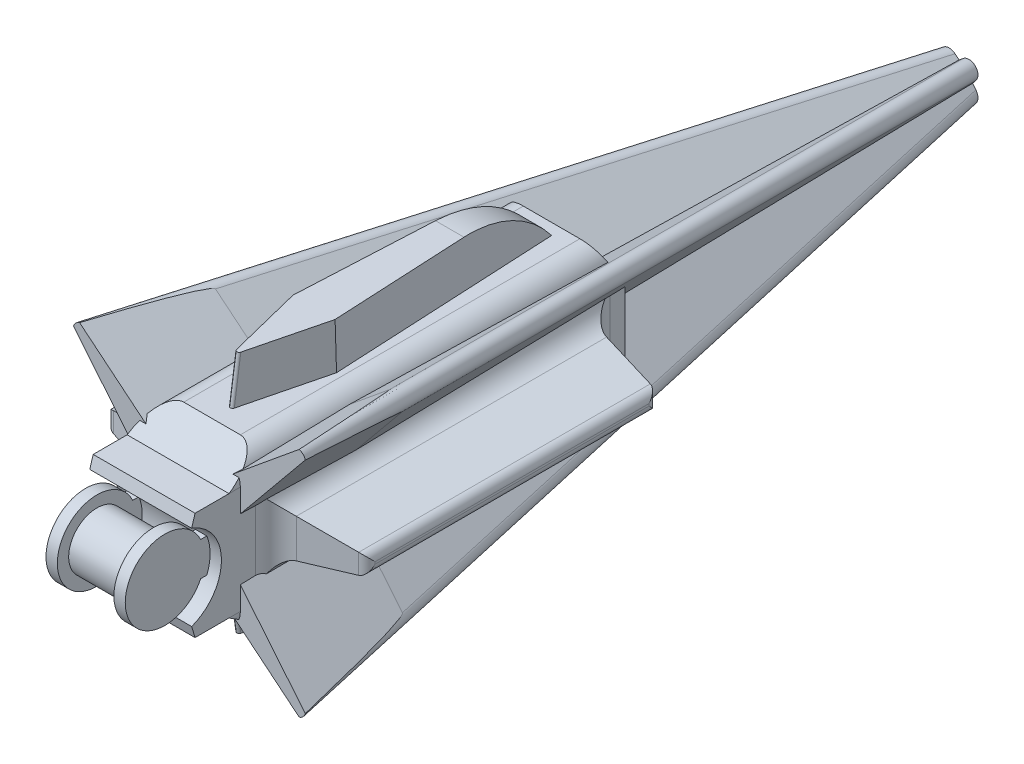
from build123d import *

# Parameters (mm, degrees)
SKETCH1_R                     = 3.175
BOSS_EXTRUDE1_DEPTH           = 3.175
SKETCH2_R                     = 4.444999999999999
BOSS_EXTRUDE2_DEPTH           = 1.27
BOSS_EXTRUDE3_DEPTH           = 1.27
BOSS_EXTRUDE4_DEPTH           = 8.89
BOSS_EXTRUDE4_DEPTH_BACK      = 2.54
SKETCH5_R                     = 3.175
CUT_EXTRUDE1_DEPTH            = 12.7
FILLET1_R                     = 2.54
SKETCH6_W                     = 35.559999999999995
SKETCH6_H                     = 5.08
BOSS_EXTRUDE5_DEPTH           = 8.889999999999999
BOSS_EXTRUDE5_TAPER           = 10.000000000000021
FILLET2_R                     = 1.016
FILLET3_R                     = 2.54
BOSS_EXTRUDE6_DEPTH           = 5.079999999999994
BOSS_EXTRUDE6_TAPER           = 2.000000000000002
FILLET4_R                     = 0.254
FILLET5_R                     = 12.7
BOSS_EXTRUDE7_DEPTH           = 73.66
BOSS_EXTRUDE7_TAPER           = 1.0000000000000022
BOSS_EXTRUDE7_OTHER_WAY_DEPTH = 12.700000000000001
BOSS_EXTRUDE7_OTHER_WAY_TAPER = 1.0000000000000022
FILLET6_R                     = 1.016


with BuildPart() as part:
    # Sketch1 → Boss-Extrude1 (new, symmetric)
    with BuildSketch(Plane(origin=(0, 0, 0), x_dir=(0, 0, -1), z_dir=(1, 0, 0))):
        Circle(SKETCH1_R)
    extrude(amount=BOSS_EXTRUDE1_DEPTH, both=True)

    # Sketch2 → Boss-Extrude2 (add)
    with BuildSketch(Plane(origin=(3.175, 0, 0), x_dir=(0, 0, -1), z_dir=(1, 0, 0))):
        Circle(SKETCH2_R)
    boss_extrude2 = extrude(amount=BOSS_EXTRUDE2_DEPTH)

    # Mirror1: Boss-Extrude2 across plane
    add(boss_extrude2.mirror(Plane(origin=(0, 0, 0), x_dir=(0, 0, 1), z_dir=(1, 0, 0))))

    # Sketch3 → Boss-Extrude3 (add)
    with BuildSketch(Plane(origin=(4.445, 0, 0), x_dir=(0, 0, -1), z_dir=(1, 0, 0))):
        Polygon((-7.3e-16, 1.9049999999999998), (6.349999999999998, 1.9050000000000038), (6.349999999999999, -1.9049999999999998), (4.4e-16, -1.9049999999999998), align=None)
    boss_extrude3 = extrude(amount=-BOSS_EXTRUDE3_DEPTH)

    # Mirror2: Boss-Extrude3 across plane
    add(boss_extrude3.mirror(Plane(origin=(0, 0, 0), x_dir=(0, 0, 1), z_dir=(1, 0, 0))))

    # Sketch4 → Boss-Extrude4 (add, two sides: drawn at the far end of the back side and taken through both)
    with BuildSketch(Plane(origin=(-3.175, 0, 0), x_dir=(0, 0, -1), z_dir=(1, 0, 0)).offset(-BOSS_EXTRUDE4_DEPTH_BACK)):
        with BuildLine():
            Line((1.7374623280944008, 4.773638513592414), (2.1184623280943997, 6.0436385135924136))
            Line((2.1184623280943997, 6.0436385135924136), (5.928462328094399, 6.0436385135924136))
            Line((5.928462328094399, 6.0436385135924136), (9.738462328094398, 8.583638513592414))
            Line((9.738462328094398, 8.583638513592414), (47.838462328094394, 8.583638513592414))
            Line((47.838462328094394, 8.583638513592414), (50.3784623280944, 3.8099999999999996))
            Line((50.3784623280944, 3.8099999999999996), (50.3784623280944, -3.8099999999999996))
            Line((50.3784623280944, -3.8099999999999996), (47.838462328094394, -8.583638513592414))
            Line((47.838462328094394, -8.583638513592414), (9.738462328094398, -8.583638513592414))
            Line((9.738462328094398, -8.583638513592414), (5.928462328094399, -6.0436385135924136))
            Line((5.928462328094399, -6.0436385135924136), (2.1184623280943997, -6.0436385135924136))
            Line((2.1184623280943997, -6.0436385135924136), (1.7374623280944008, -4.773638513592414))
            ThreePointArc((1.7374623280944008, -4.773638513592414), (5.080000000000001, 0), (1.7374623280944008, 4.773638513592414))
        make_face()
    extrude(amount=BOSS_EXTRUDE4_DEPTH + BOSS_EXTRUDE4_DEPTH_BACK)

    # Sketch5 → Cut-Extrude1 (cut)
    with BuildSketch(Plane(origin=(0, 0, -50.3784623280944), x_dir=(-1, 0, 0), z_dir=(0, 0, -1))):
        Circle(SKETCH5_R)
    extrude(amount=-CUT_EXTRUDE1_DEPTH, mode=Mode.SUBTRACT)

    # Fillet1
    fillet1_edges = [part.edges().sort_by_distance(p)[0] for p in [
        (5.715000000000001, -8.583638513592414, -28.788462328094397),
        (-5.715, -8.583638513592414, -28.788462328094397),
        (-5.715, 8.583638513592414, -28.788462328094397),
        (5.715000000000001, 8.583638513592414, -28.788462328094397),
    ]]
    fillet(fillet1_edges, radius=FILLET1_R)

    # Sketch6 → Boss-Extrude5 (add)
    with BuildSketch(Plane(origin=(5.715000000000001, 0, 0), x_dir=(0, 0, -1), z_dir=(1, 0, 0))):
        with Locations((28.7884623280944, 0)):
            Rectangle(SKETCH6_W, SKETCH6_H)
    boss_extrude5 = extrude(amount=BOSS_EXTRUDE5_DEPTH, taper=BOSS_EXTRUDE5_TAPER)

    # Mirror3: Boss-Extrude5 across plane
    add(boss_extrude5.mirror(Plane(origin=(0, 0, 0), x_dir=(0, 0, 1), z_dir=(1, 0, 0))))

    # Fillet2
    fillet2_edges = [part.edges().sort_by_distance(p)[0] for p in [
        (14.605, -1.6e-16, -12.57600918659266),
        (14.605, -0.9724531415017433, -28.788462328094404),
        (14.605, -1.6e-16, -45.00091546959614),
        (14.605, 0.9724531415017431, -28.788462328094397),
        (-14.605, -1.6e-16, -12.57600918659266),
        (-14.605, 0.9724531415017431, -28.788462328094397),
        (-14.605, -1.6e-16, -45.00091546959614),
        (-14.605, -0.9724531415017433, -28.788462328094404),
    ]]
    fillet(fillet2_edges, radius=FILLET2_R)

    # Fillet3
    fillet3_edges = [part.edges().sort_by_distance(p)[0] for p in [
        (5.715000000000001, 0, -11.008462328094403),
        (5.715000000000001, -2.54, -28.7884623280944),
        (5.715000000000001, 0, -46.5684623280944),
        (5.715000000000001, 2.54, -28.7884623280944),
        (-5.715000000000001, 0, -11.008462328094403),
        (-5.715000000000001, -2.54, -28.7884623280944),
        (-5.715000000000001, 0, -46.5684623280944),
        (-5.715000000000001, 2.54, -28.7884623280944),
    ]]
    fillet(fillet3_edges, radius=FILLET3_R)

    # Sketch7 → Boss-Extrude6 (add)
    with BuildSketch(Plane(origin=(0, 8.583638513592414, 0), x_dir=(1, 0, 0), z_dir=(0, 1, 0))):
        Polygon((-1.27, 46.568462328094405), (-2.5399999999999983, 21.168462328094403), (0, 11.0084623280944), (2.5399999999999983, 21.168462328094403), (1.27, 46.568462328094405), align=None)
    boss_extrude6 = extrude(amount=BOSS_EXTRUDE6_DEPTH, taper=BOSS_EXTRUDE6_TAPER)

    # Mirror4: Boss-Extrude6 across plane
    add(boss_extrude6.mirror(Plane.ZX))

    # Fillet4
    fillet4_edges = [part.edges().sort_by_distance(p)[0] for p in [
        (0, 11.123638513592411, -11.3741766617959),
        (0, -11.123638513592411, -11.3741766617959),
    ]]
    fillet(fillet4_edges, radius=FILLET4_R)

    # Fillet5
    # the kernel refuses this fillet: 12.7 mm, written as the material it takes off along each edge
    with BuildSketch(Plane(origin=(26.057756985420163, -13.663638513592407, -46.39106481907633), x_dir=(0, 0.9993908270190958, -0.03489949670250099), z_dir=(-1, 0, 0))) as fillet5_piece_1:
        with BuildLine():
            CenterArc((12.343875700426112, -10.419744967387068), FILLET5_R, 124.86989764584403, 53.130102354155966)
            Line((-0.34838780271640163, -9.976521359265305), (-0.6022330727792515, -9.96765688710287))
            Line((-0.6022330727792515, -9.96765688710287), (-0.2538452700628499, 0.00886447216243524))
            Line((-0.2538452700628499, 0.00886447216243524), (6.6e-16, 0.2539999999999965))
            ThreePointArc((6.6e-16, 0.2539999999999965), (2.5415482425190037, 0.25399999999999656), (4.9378809007302475, 0.2083948993477439))
            Line((4.9378809007302475, 0.2083948993477439), (5.083096485038009, 0))
        make_face()
    extrude(amount=52.11551397084032, mode=Mode.SUBTRACT)
    with BuildSketch(Plane(origin=(26.057756985420163, 13.663638513592407, -46.39106481907633), x_dir=(0, -0.9993908270190958, -0.03489949670250099), z_dir=(-1, 0, 0))) as fillet5_piece_2:
        with BuildLine():
            CenterArc((12.343875700426112, 10.419744967387068), FILLET5_R, 182, 53.13010235415595)
            Line((-0.34838780271640163, 9.976521359265305), (-0.6022330727792515, 9.96765688710287))
            Line((-0.6022330727792515, 9.96765688710287), (-0.2538452700628499, -0.00886447216243524))
            Line((-0.2538452700628499, -0.00886447216243524), (6.6e-16, -0.2539999999999965))
            ThreePointArc((6.6e-16, -0.2539999999999965), (2.5415482425190037, -0.25399999999999656), (4.9378809007302475, -0.2083948993477439))
            Line((4.9378809007302475, -0.2083948993477439), (5.083096485038009, 0))
        make_face()
    extrude(amount=52.11551397084032, mode=Mode.SUBTRACT)

    # Sketch8 → Boss-Extrude7 (add)
    with BuildSketch(Plane(origin=(0, 0, -19.8984623280944), x_dir=(-1, 0, 0), z_dir=(0, 0, -1))):
        Polygon((0, 3.175), (-17.779999999999934, 17.779999999999987), (-3.175, -2e-16), (-17.779999999999934, -17.779999999999987), (0, -3.175), (17.779999999999934, -17.78), (3.175, 0), (17.779999999999934, 17.78), align=None)
    extrude(amount=BOSS_EXTRUDE7_DEPTH, taper=BOSS_EXTRUDE7_TAPER)

    # Sketch8 → Boss-Extrude7 other way (add)
    with BuildSketch(Plane(origin=(0, 0, -19.8984623280944), x_dir=(-1, 0, 0), z_dir=(0, 0, -1))):
        Polygon((0, 3.175), (-17.779999999999934, 17.779999999999987), (-3.175, -2e-16), (-17.779999999999934, -17.779999999999987), (0, -3.175), (17.779999999999934, -17.78), (3.175, 0), (17.779999999999934, 17.78), align=None)
    extrude(amount=-BOSS_EXTRUDE7_OTHER_WAY_DEPTH, taper=BOSS_EXTRUDE7_OTHER_WAY_TAPER)

    # Fillet6
    # the kernel refuses this fillet: 1.016 mm, written as the material it takes off along each edge
    with BuildSketch(Plane(origin=(-20.95567858297953, -20.95567858297961, 5.206103382012049), x_dir=(0.7627077129659504, 0.622551588883571, 0.17523259902424146), z_dir=(0.12452118344129766, 0.12452118344129816, -0.984372363360917))) as fillet6_piece_1:
        with BuildLine():
            CenterArc((FILLET6_R * 10.0405981063, -FILLET6_R), FILLET6_R, 90.0000000000001, 168.62469070380405)
            Line((FILLET6_R * 9.84336321649, -FILLET6_R * 1.98035626088), (0, 0))
            Line((0, 0), (FILLET6_R * 10.0405981063, 3e-17))
        make_face()
    extrude(amount=125.83564515900238, mode=Mode.SUBTRACT)
    with BuildSketch(Plane(origin=(-20.95567858297728, 20.955678582977363, 5.2061033819942395), x_dir=(0.7627077129659501, -0.6225515888835714, 0.17523259902424151), z_dir=(0.12452118344129769, -0.12452118344129823, -0.984372363360917))) as fillet6_piece_2:
        with BuildLine():
            CenterArc((FILLET6_R * 10.0405981063, FILLET6_R), FILLET6_R, 101.37530929619633, 168.62469070380357)
            Line((FILLET6_R * 9.84336321649, FILLET6_R * 1.98035626088), (0, 0))
            Line((0, 0), (FILLET6_R * 10.0405981063, 7e-17))
        make_face()
    extrude(amount=125.8356451589662, mode=Mode.SUBTRACT)
    with BuildSketch(Plane(origin=(20.955678582977644, -20.955678582977715, 5.2061033819972735), x_dir=(-0.6225515888835683, 0.7627077129659525, 0.1752325990242418), z_dir=(-0.1245211834412979, 0.1245211834412984, -0.984372363360917))) as fillet6_piece_3:
        with BuildLine():
            CenterArc((FILLET6_R * 10.0405981063, -FILLET6_R), FILLET6_R, 90, 168.62469070380405)
            Line((FILLET6_R * 9.84336321649, -FILLET6_R * 1.98035626088), (0, 0))
            Line((0, 0), (FILLET6_R * 10.0405981063, 8.1e-16))
        make_face()
    extrude(amount=125.83564515897237, mode=Mode.SUBTRACT)
    with BuildSketch(Plane(origin=(20.955678582978695, 20.95567858297876, 5.2061033820054945), x_dir=(-0.7627077129659505, -0.6225515888835708, 0.17523259902424118), z_dir=(-0.12452118344129749, -0.12452118344129792, -0.984372363360917))) as fillet6_piece_4:
        with BuildLine():
            CenterArc((FILLET6_R * 10.0405981063, -FILLET6_R), FILLET6_R, 90, 168.62469070380394)
            Line((FILLET6_R * 9.84336321649, -FILLET6_R * 1.98035626088), (0, 0))
            Line((0, 0), (FILLET6_R * 10.0405981063, -1.51e-15))
        make_face()
    extrude(amount=125.83564515898904, mode=Mode.SUBTRACT)


solid = part.part
